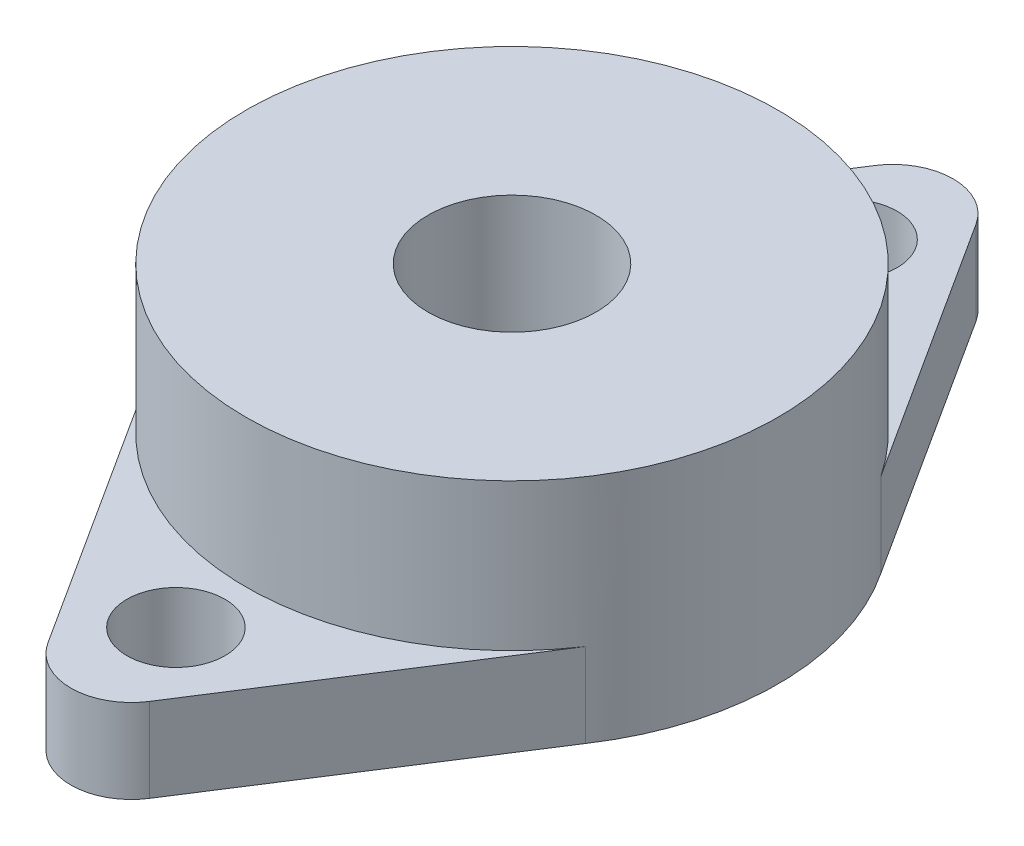
from build123d import *

# Parameters (mm, degrees)
SKETCH1_R           = 19
BOSS_EXTRUDE1_DEPTH = 16.5
BOSS_EXTRUDE2_DEPTH = 6
SKETCH3_R           = 6
CUT_EXTRUDE1_DEPTH  = 41.317490001
SKETCH4_R           = 3.5
CUT_EXTRUDE2_DEPTH  = 39.255718527


with BuildPart() as part:
    # Sketch1 → Boss-Extrude1 (new body)
    with BuildSketch(Plane(origin=(0, 0, 0), x_dir=(1, 0, 0), z_dir=(0, 1, 0))):
        Circle(SKETCH1_R)
    extrude(amount=BOSS_EXTRUDE1_DEPTH)

    # Sketch2 → Boss-Extrude2 (add)
    with BuildSketch(Plane(origin=(0, 0, 0), x_dir=(1, 0, 0), z_dir=(0, 1, 0))):
        with BuildLine():
            ThreePointArc((3.61947725, 29.522681746), (0, 31.5), (-3.61947725, 29.522681746))
            Line((-3.61947725, 29.522681746), (-15.801925878, 10.549840688))
            Line((-15.801925878, 10.549840688), (15.801925878, 10.549840688))
            Line((15.801925878, 10.549840688), (3.61947725, 29.522681746))
        make_face()
    boss_extrude2 = extrude(amount=BOSS_EXTRUDE2_DEPTH)

    # Sketch3 → Cut-Extrude1 (cut, through all)
    with BuildSketch(Plane(origin=(0, 16.5, 0), x_dir=(1, 0, 0), z_dir=(0, 1, 0))):
        Circle(SKETCH3_R)
    extrude(amount=-CUT_EXTRUDE1_DEPTH, mode=Mode.SUBTRACT)

    # Sketch4 → Cut-Extrude2 (cut, through all)
    with BuildSketch(Plane(origin=(0, 6, 0), x_dir=(1, 0, 0), z_dir=(0, 1, 0))):
        with Locations((0, 24)):
            Circle(SKETCH4_R)
    cut_extrude2 = extrude(amount=-CUT_EXTRUDE2_DEPTH, mode=Mode.SUBTRACT)

    # Mirror1: Boss-Extrude2, Cut-Extrude2 across plane
    add(boss_extrude2.mirror(Plane.XY))
    add(cut_extrude2.mirror(Plane.XY), mode=Mode.SUBTRACT)


solid = part.part
